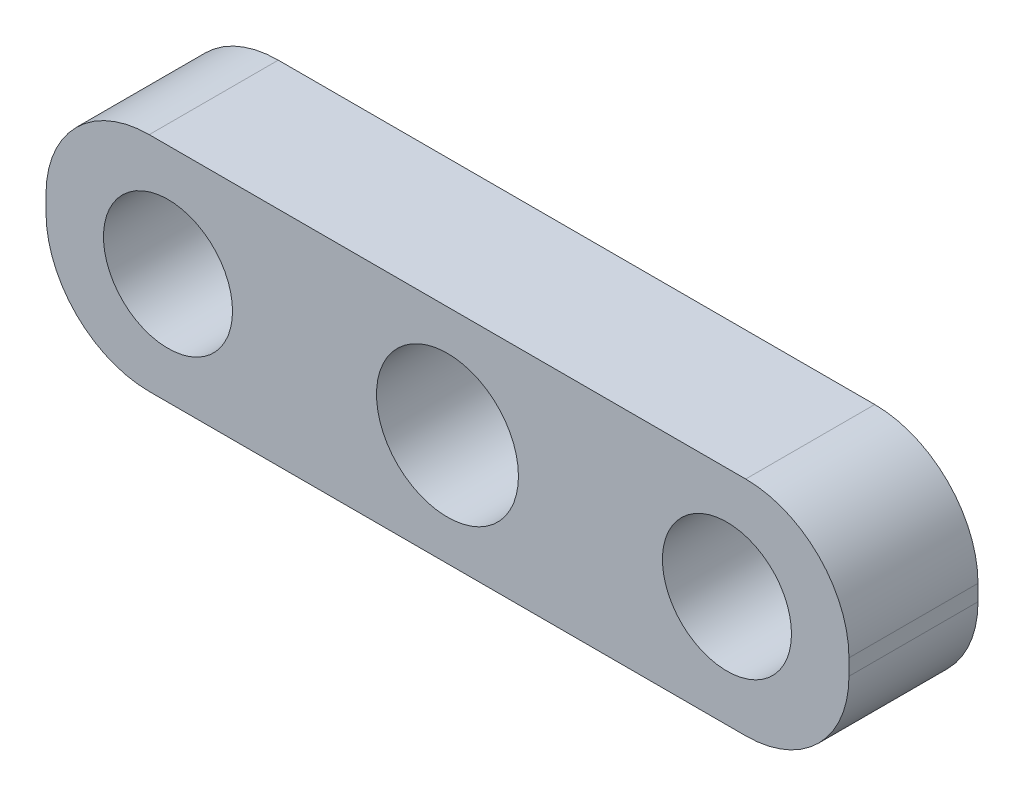
from build123d import *

# Parameters (mm, degrees)
SKETCH1_W           = 31.110669922
SKETCH1_H           = 8.618657178
SKETCH1_R           = 2.5
BOSS_EXTRUDE1_DEPTH = 5
SKETCH2_R           = 2.75
CUT_EXTRUDE1_DEPTH  = 22.76046651
FILLET1_R           = 4


with BuildPart() as part:
    # Sketch1 → Boss-Extrude1 (new body)
    with BuildSketch(Plane.XY):
        with Locations((0, 10.0625)):
            Rectangle(SKETCH1_W, SKETCH1_H)
        with Locations((10.828492502, 10.0625)):
            Circle(SKETCH1_R, mode=Mode.SUBTRACT)
        with Locations((-10.828492502, 10.0625)):
            Circle(SKETCH1_R, mode=Mode.SUBTRACT)
    extrude(amount=BOSS_EXTRUDE1_DEPTH)

    # Sketch2 → Cut-Extrude1 (cut, through all)
    with BuildSketch(Plane.XY.offset(5)):
        with Locations((0, 10.0625)):
            Circle(SKETCH2_R)
    extrude(amount=-CUT_EXTRUDE1_DEPTH, mode=Mode.SUBTRACT)

    # Fillet1
    fillet1_edges = [part.edges().sort_by_distance(p)[0] for p in [
        (-15.555334961, 14.371828589, 2.5),
        (15.555334961, 14.371828589, 2.5),
        (15.555334961, 5.753171411, 2.5),
        (-15.555334961, 5.753171411, 2.5),
    ]]
    fillet(fillet1_edges, radius=FILLET1_R)


solid = part.part
